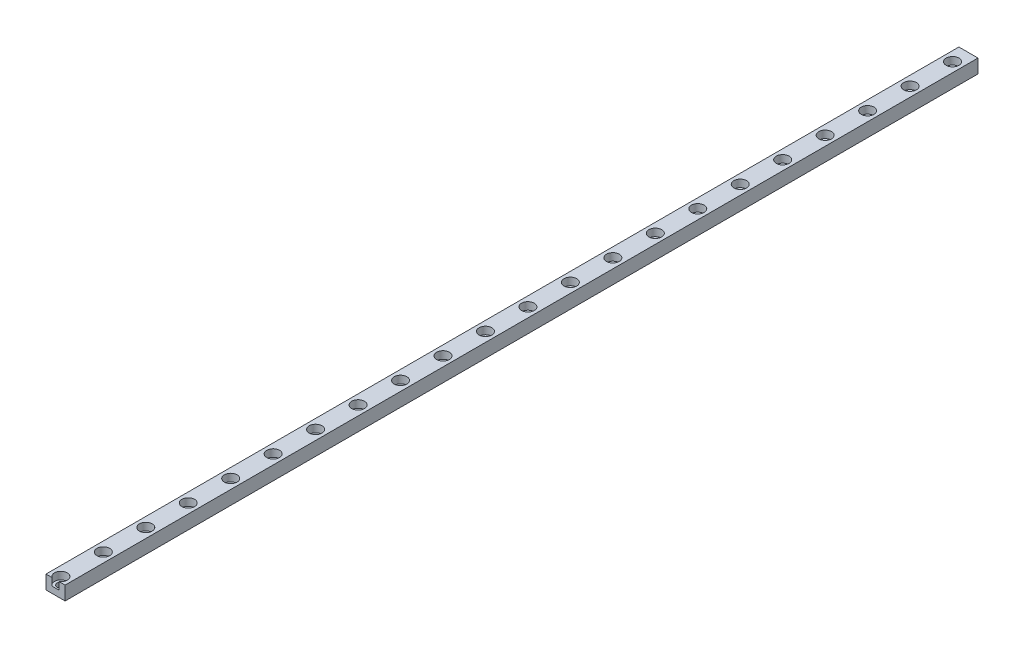
from build123d import *

# Parameters (mm, degrees)
SKETCH_1_W          = 9
SKETCH_1_H          = 6.5
EXTRUDE_1_DEPTH     = 430
SKETCH_2_R          = 1.750000006
CUT_EXTRUDE_1_DEPTH = 341.826868595
SKETCH_3_R          = 3.000000006
CUT_EXTRUDE_2_DEPTH = 3.5


with BuildPart() as part:
    # 草图1 → 凸台-拉伸1 (new body)
    with BuildSketch(Plane.XY.offset(-89.264832522)):
        Rectangle(SKETCH_1_W, SKETCH_1_H)
    extrude(amount=EXTRUDE_1_DEPTH)

    # 草图2 → 切除-拉伸1 (cut, through all)
    with BuildSketch(Plane(origin=(0, 3.25, 0), x_dir=(1, 0, 0), z_dir=(0, 1, 0))):
        with Locations((0, 81.764832522)):
            Circle(SKETCH_2_R)
        with Locations((0, 61.764832522)):
            Circle(SKETCH_2_R)
        with Locations((0, 41.764832522)):
            Circle(SKETCH_2_R)
        with Locations((0, 21.764832522)):
            Circle(SKETCH_2_R)
        with Locations((0, 1.764832522)):
            Circle(SKETCH_2_R)
        with Locations((0, -18.235167478)):
            Circle(SKETCH_2_R)
        with Locations((0, -38.235167478)):
            Circle(SKETCH_2_R)
        with Locations((0, -58.235167478)):
            Circle(SKETCH_2_R)
        with Locations((0, -78.235167478)):
            Circle(SKETCH_2_R)
        with Locations((0, -98.235167478)):
            Circle(SKETCH_2_R)
        with Locations((0, -118.235167478)):
            Circle(SKETCH_2_R)
        with Locations((0, -138.235167478)):
            Circle(SKETCH_2_R)
        with Locations((0, -158.235167478)):
            Circle(SKETCH_2_R)
        with Locations((0, -178.235167478)):
            Circle(SKETCH_2_R)
        with Locations((0, -198.235167478)):
            Circle(SKETCH_2_R)
        with Locations((0, -218.235167478)):
            Circle(SKETCH_2_R)
        with Locations((0, -238.235167478)):
            Circle(SKETCH_2_R)
        with Locations((0, -258.235167478)):
            Circle(SKETCH_2_R)
        with Locations((0, -278.235167478)):
            Circle(SKETCH_2_R)
        with Locations((0, -298.235167478)):
            Circle(SKETCH_2_R)
        with Locations((0, -318.235167478)):
            Circle(SKETCH_2_R)
        with Locations((0, -338.235167478)):
            Circle(SKETCH_2_R)
        with Locations((0, -358.235167478)):
            Circle(SKETCH_2_R)
        with Locations((0, -378.235167478)):
            Circle(SKETCH_2_R)
        with Locations((0, -398.235167478)):
            Circle(SKETCH_2_R)
        with Locations((0, -418.235167478)):
            Circle(SKETCH_2_R)
        with Locations((0, -438.235167478)):
            Circle(SKETCH_2_R)
        with Locations((0, -458.235167478)):
            Circle(SKETCH_2_R)
        with Locations((0, -478.235167478)):
            Circle(SKETCH_2_R)
        with Locations((0, -498.235167478)):
            Circle(SKETCH_2_R)
        with Locations((0, -518.235167478)):
            Circle(SKETCH_2_R)
        with Locations((0, -538.235167478)):
            Circle(SKETCH_2_R)
        with Locations((0, -558.235167478)):
            Circle(SKETCH_2_R)
        with Locations((0, -578.235167478)):
            Circle(SKETCH_2_R)
        with Locations((0, -598.235167478)):
            Circle(SKETCH_2_R)
        with Locations((0, -618.235167478)):
            Circle(SKETCH_2_R)
        with Locations((0, -638.235167478)):
            Circle(SKETCH_2_R)
        with Locations((0, -658.235167478)):
            Circle(SKETCH_2_R)
        with Locations((0, -678.235167478)):
            Circle(SKETCH_2_R)
        with Locations((0, -698.235167478)):
            Circle(SKETCH_2_R)
        with Locations((0, -718.235167478)):
            Circle(SKETCH_2_R)
        with Locations((0, -738.235167478)):
            Circle(SKETCH_2_R)
        with Locations((0, -758.235167478)):
            Circle(SKETCH_2_R)
        with Locations((0, -778.235167478)):
            Circle(SKETCH_2_R)
        with Locations((0, -798.235167478)):
            Circle(SKETCH_2_R)
        with Locations((0, -818.235167478)):
            Circle(SKETCH_2_R)
        with Locations((0, -838.235167478)):
            Circle(SKETCH_2_R)
        with Locations((0, -858.235167478)):
            Circle(SKETCH_2_R)
        with Locations((0, -878.235167478)):
            Circle(SKETCH_2_R)
        with Locations((0, -898.235167478)):
            Circle(SKETCH_2_R)
        with Locations((0, -918.235167478)):
            Circle(SKETCH_2_R)
        with Locations((0, -938.235167478)):
            Circle(SKETCH_2_R)
        with Locations((0, -958.235167478)):
            Circle(SKETCH_2_R)
        with Locations((0, -978.235167478)):
            Circle(SKETCH_2_R)
        with Locations((0, -998.235167478)):
            Circle(SKETCH_2_R)
        with Locations((0, -1018.235167478)):
            Circle(SKETCH_2_R)
        with Locations((0, -1038.235167478)):
            Circle(SKETCH_2_R)
        with Locations((0, -1058.235167478)):
            Circle(SKETCH_2_R)
        with Locations((0, -1078.235167478)):
            Circle(SKETCH_2_R)
        with Locations((0, -1098.235167478)):
            Circle(SKETCH_2_R)
    extrude(amount=-CUT_EXTRUDE_1_DEPTH, mode=Mode.SUBTRACT)

    # 草图3 → 切除-拉伸2 (cut)
    with BuildSketch(Plane(origin=(0, 3.25, 0), x_dir=(1, 0, 0), z_dir=(0, 1, 0))):
        with Locations((0, 81.764832522)):
            Circle(SKETCH_3_R)
        with Locations((0, 61.764832522)):
            Circle(SKETCH_3_R)
        with Locations((0, 41.764832522)):
            Circle(SKETCH_3_R)
        with Locations((0, 21.764832522)):
            Circle(SKETCH_3_R)
        with Locations((0, 1.764832522)):
            Circle(SKETCH_3_R)
        with Locations((0, -18.235167478)):
            Circle(SKETCH_3_R)
        with Locations((0, -38.235167478)):
            Circle(SKETCH_3_R)
        with Locations((0, -58.235167478)):
            Circle(SKETCH_3_R)
        with Locations((0, -78.235167478)):
            Circle(SKETCH_3_R)
        with Locations((0, -98.235167478)):
            Circle(SKETCH_3_R)
        with Locations((0, -118.235167478)):
            Circle(SKETCH_3_R)
        with Locations((0, -138.235167478)):
            Circle(SKETCH_3_R)
        with Locations((0, -158.235167478)):
            Circle(SKETCH_3_R)
        with Locations((0, -178.235167478)):
            Circle(SKETCH_3_R)
        with Locations((0, -198.235167478)):
            Circle(SKETCH_3_R)
        with Locations((0, -218.235167478)):
            Circle(SKETCH_3_R)
        with Locations((0, -238.235167478)):
            Circle(SKETCH_3_R)
        with Locations((0, -258.235167478)):
            Circle(SKETCH_3_R)
        with Locations((0, -278.235167478)):
            Circle(SKETCH_3_R)
        with Locations((0, -298.235167478)):
            Circle(SKETCH_3_R)
        with Locations((0, -318.235167478)):
            Circle(SKETCH_3_R)
        with Locations((0, -338.235167478)):
            Circle(SKETCH_3_R)
        with Locations((0, -358.235167478)):
            Circle(SKETCH_3_R)
        with Locations((0, -378.235167478)):
            Circle(SKETCH_3_R)
        with Locations((0, -398.235167478)):
            Circle(SKETCH_3_R)
        with Locations((0, -418.235167478)):
            Circle(SKETCH_3_R)
        with Locations((0, -438.235167478)):
            Circle(SKETCH_3_R)
        with Locations((0, -458.235167478)):
            Circle(SKETCH_3_R)
        with Locations((0, -478.235167478)):
            Circle(SKETCH_3_R)
        with Locations((0, -498.235167478)):
            Circle(SKETCH_3_R)
        with Locations((0, -518.235167478)):
            Circle(SKETCH_3_R)
        with Locations((0, -538.235167478)):
            Circle(SKETCH_3_R)
        with Locations((0, -558.235167478)):
            Circle(SKETCH_3_R)
        with Locations((0, -578.235167478)):
            Circle(SKETCH_3_R)
        with Locations((0, -598.235167478)):
            Circle(SKETCH_3_R)
        with Locations((0, -618.235167478)):
            Circle(SKETCH_3_R)
        with Locations((0, -638.235167478)):
            Circle(SKETCH_3_R)
        with Locations((0, -658.235167478)):
            Circle(SKETCH_3_R)
        with Locations((0, -678.235167478)):
            Circle(SKETCH_3_R)
        with Locations((0, -698.235167478)):
            Circle(SKETCH_3_R)
        with Locations((0, -718.235167478)):
            Circle(SKETCH_3_R)
        with Locations((0, -738.235167478)):
            Circle(SKETCH_3_R)
        with Locations((0, -758.235167478)):
            Circle(SKETCH_3_R)
        with Locations((0, -778.235167478)):
            Circle(SKETCH_3_R)
        with Locations((0, -798.235167478)):
            Circle(SKETCH_3_R)
        with Locations((0, -818.235167478)):
            Circle(SKETCH_3_R)
        with Locations((0, -838.235167478)):
            Circle(SKETCH_3_R)
        with Locations((0, -858.235167478)):
            Circle(SKETCH_3_R)
        with Locations((0, -878.235167478)):
            Circle(SKETCH_3_R)
        with Locations((0, -898.235167478)):
            Circle(SKETCH_3_R)
        with Locations((0, -918.235167478)):
            Circle(SKETCH_3_R)
        with Locations((0, -938.235167478)):
            Circle(SKETCH_3_R)
        with Locations((0, -958.235167478)):
            Circle(SKETCH_3_R)
        with Locations((0, -978.235167478)):
            Circle(SKETCH_3_R)
        with Locations((0, -998.235167478)):
            Circle(SKETCH_3_R)
        with Locations((0, -1018.235167478)):
            Circle(SKETCH_3_R)
        with Locations((0, -1038.235167478)):
            Circle(SKETCH_3_R)
        with Locations((0, -1058.235167478)):
            Circle(SKETCH_3_R)
        with Locations((0, -1078.235167478)):
            Circle(SKETCH_3_R)
        with Locations((0, -1098.235167478)):
            Circle(SKETCH_3_R)
    extrude(amount=-CUT_EXTRUDE_2_DEPTH, mode=Mode.SUBTRACT)


solid = part.part
